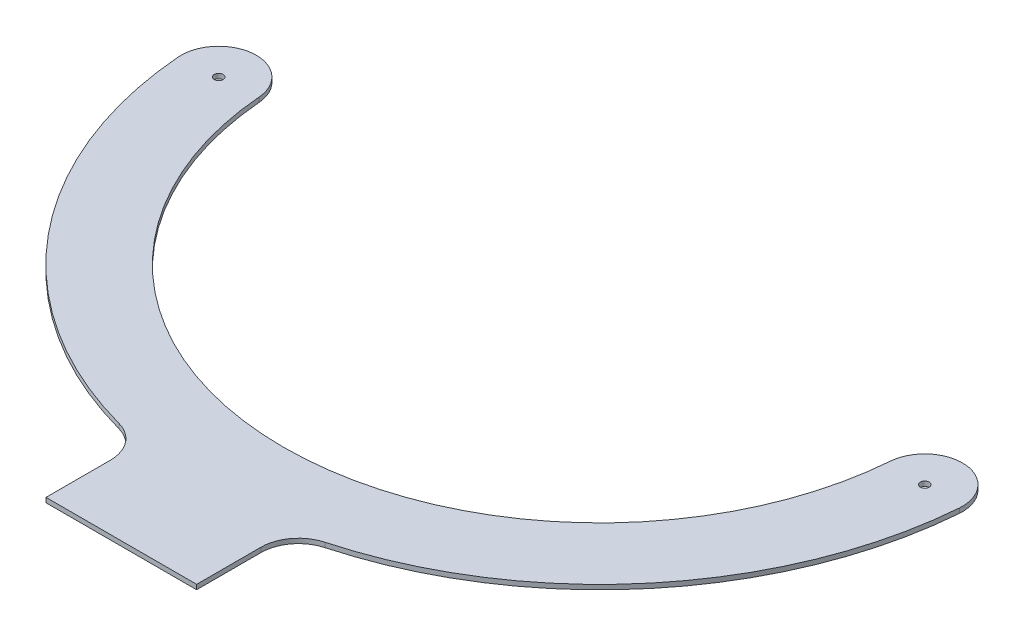
from build123d import *

# Parameters (mm, degrees)
BOSS_EXTRUDE1_DEPTH = 3.175
SKETCH2_R           = 3.007999953
CUT_EXTRUDE1_DEPTH  = 422.702636617
FILLET1_R           = 25.4


with BuildPart() as part:
    # Sketch1 → Boss-Extrude1 (new body)
    with BuildSketch(Plane(origin=(0, 0, 0), x_dir=(1, 0, 0), z_dir=(0, 1, 0))):
        with BuildLine():
            Line((50.8, 0), (-50.8, 0))
            Line((-50.8, 0), (-50.8, 63.5))
            ThreePointArc((-50.8, 63.5), (-197.184988418, 146.888637408), (-263.444108075, 301.782016043))
            ThreePointArc((-263.444108075, 301.782016043), (-240.150528646, 329.126652764), (-212.805891925, 305.833073335))
            ThreePointArc((-212.805891925, 305.833073335), (0, 109.371760003), (212.805891925, 305.833073335))
            ThreePointArc((212.805891925, 305.833073335), (240.150528646, 329.126652764), (263.444108075, 301.782016043))
            ThreePointArc((263.444108075, 301.782016043), (197.184988418, 146.888637408), (50.8, 63.5))
            Line((50.8, 63.5), (50.8, 0))
        make_face()
    extrude(amount=BOSS_EXTRUDE1_DEPTH)

    # Sketch2 → Cut-Extrude1 (cut, through all)
    with BuildSketch(Plane(origin=(0, 3.175, 0), x_dir=(1, 0, 0), z_dir=(0, 1, 0))):
        with Locations((-238.125, 303.807544689)):
            Circle(SKETCH2_R)
        with Locations((238.125, 303.807544689)):
            Circle(SKETCH2_R)
    extrude(amount=-CUT_EXTRUDE1_DEPTH, mode=Mode.SUBTRACT)

    # Fillet1
    fillet1_edges = [part.edges().sort_by_distance(p)[0] for p in [
        (50.8, 1.5875, -63.5),
        (-50.8, 1.5875, -63.5),
    ]]
    fillet(fillet1_edges, radius=FILLET1_R)


solid = part.part
